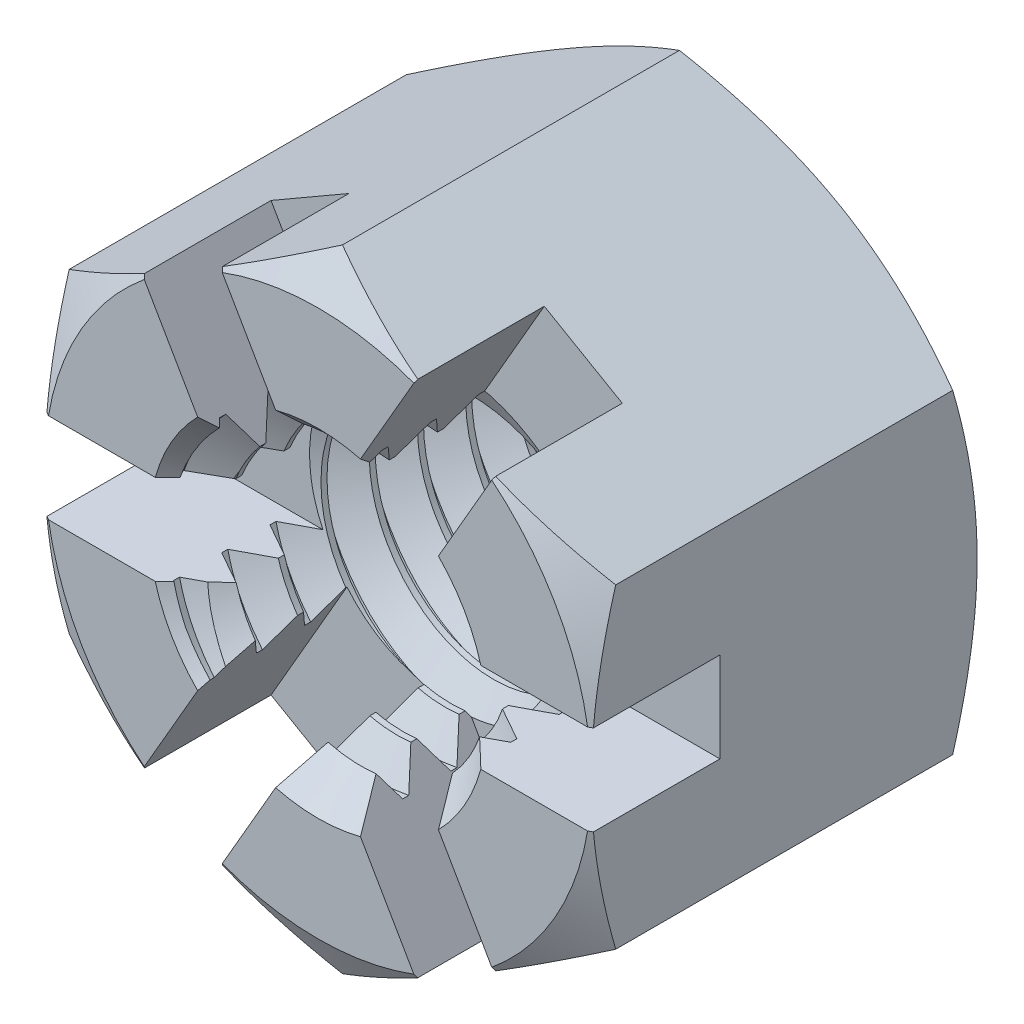
from build123d import *

# Parameters (mm, degrees)
EXTRUDE1_DEPTH      = 12
SKETCH3_OUTSIDE_W   = 89.43
SKETCH3_OUTSIDE_H   = 92.06
SKETCH3_OUTSIDE_R   = 8.5
CUT_EXTRUDE2_DEPTH  = 18.680026395
CUT_EXTRUDE2_DRAFT  = -60
SKETCH4_R           = 5
CUT_EXTRUDE3_DEPTH  = 18.680026395
SKETCH12_R          = 5
SKETCH12_R_2        = 4.025721421
EXTRUDE2_DEPTH      = 12
CUT_SWEEP1_PITCH    = 1.5
SKETCH16_OUTSIDE_W  = 89.43
SKETCH16_OUTSIDE_H  = 92.06
SKETCH16_OUTSIDE_R  = 8.5
CUT_EXTRUDE11_DEPTH = 18.680026463
CUT_EXTRUDE11_DRAFT = -60
CUT_EXTRUDE8_DEPTH  = 4
CIRPATTERN1_COUNT   = 6


with BuildPart() as part:
    # Sketch1 → Extrude1 (new body)
    with BuildSketch(Plane.XY):
        Polygon((0, 9.814954576), (-8.5, 4.907477288), (-8.5, -4.907477288), (0, -9.814954576), (8.5, -4.907477288), (8.5, 4.907477288), align=None)
    extrude(amount=-EXTRUDE1_DEPTH)


with BuildPart() as cut_extrude2_tool:
    # Sketch3 outside → Cut-Extrude2 (with draft: the straight prism first)
    with BuildSketch(Plane(origin=(0, 0, -12), x_dir=(-1, 0, 0), z_dir=(0, 0, -1))):
        Rectangle(SKETCH3_OUTSIDE_W, SKETCH3_OUTSIDE_H)
        Circle(SKETCH3_OUTSIDE_R, mode=Mode.SUBTRACT)
    extrude(amount=-CUT_EXTRUDE2_DEPTH)
    # Cut-Extrude2: the draft: its side faces are tilted about the plane it starts from
    cut_extrude2_sides = [cut_extrude2_tool.faces().sort_by_distance(p)[0] for p in [
        (0, -46.03, -2.659986802),
        (-44.715, 0, -2.659986802),
        (0, 46.03, -2.659986802),
        (44.715, 0, -2.659986802),
        (8.5, 0, -2.659986802),
    ]]
    draft(cut_extrude2_sides, Plane(origin=(0, 0, -12), x_dir=(-1, 0, 0), z_dir=(0, 0, -1)), CUT_EXTRUDE2_DRAFT)


with BuildPart() as part_1:
    add(part.part)

    # Cut-Extrude2: cut by cut_extrude2_tool
    add(cut_extrude2_tool.part, mode=Mode.SUBTRACT)

    # Sketch4 → Cut-Extrude3 (cut, through all)
    with BuildSketch(Plane.XY):
        Circle(SKETCH4_R)
    extrude(amount=-CUT_EXTRUDE3_DEPTH, mode=Mode.SUBTRACT)

    # Sketch12 → Extrude2 (add)
    with BuildSketch(Plane.XY):
        Circle(SKETCH12_R)
        Circle(SKETCH12_R_2, mode=Mode.SUBTRACT)
    extrude(amount=-EXTRUDE2_DEPTH)

    # Cut-Sweep1: the profile of Sketch9 profile screwed along a right-hand helix of 9 turns, 6 arcs to a turn; built about Z, then put on its axis
    cut_sweep1_z = Axis((0, 0, 0), (0, 0, 1))
    cut_sweep1_corners = [(5, 0, -0.75), (5, 0, -0.5625), (4.025421421, 0, 0.000173205), (4.025421421, 0, -1.312673205)]
    with BuildLine(mode=Mode.PRIVATE) as cut_sweep1_profile:
        Line(cut_sweep1_corners[0], cut_sweep1_corners[1])
        Line(cut_sweep1_corners[1], cut_sweep1_corners[2])
        Line(cut_sweep1_corners[2], cut_sweep1_corners[3])
        Line(cut_sweep1_corners[3], cut_sweep1_corners[0])
    cut_sweep1_cap = Face(cut_sweep1_profile.wire())
    cut_sweep1_turn_angles = [0, 30, 60, 90, 120, 150, 180, 210, 240, 270, 300, 330, 360]
    cut_sweep1_turn_weights = [1, 0.8660254037844387, 1, 0.8660254037844387, 1, 0.8660254037844387, 1, 0.8660254037844387, 1, 0.8660254037844387, 1, 0.8660254037844387, 1]
    cut_sweep1_turn_rails = [Edge.make_bspline([Vector(p[0], p[1], 0).rotate(cut_sweep1_z, cut_sweep1_turn_angles[k]) / cut_sweep1_turn_weights[k] + Vector(0, 0, p[2] + CUT_SWEEP1_PITCH * cut_sweep1_turn_angles[k] / 360) for k in range(13)], [0, 0, 0, 1, 1, 2, 2, 3, 3, 4, 4, 5, 5, 6, 6, 6], 2, cut_sweep1_turn_weights) for p in cut_sweep1_corners]
    cut_sweep1_turn_sides = [Face.make_surface_from_curves(cut_sweep1_turn_rails[p[0]], cut_sweep1_turn_rails[p[1]]) for p in [(0, 1), (1, 2), (2, 3), (3, 0)]]
    cut_sweep1 = Plane(origin=(0, 0, 0), x_dir=(0, 1, 0), z_dir=(0, 0, -1)) * Solid(Shell([*[p.moved(Location((0, 0, CUT_SWEEP1_PITCH * i))) for i in range(9) for p in cut_sweep1_turn_sides], cut_sweep1_cap, cut_sweep1_cap.rotate(cut_sweep1_z, 3240).moved(Location((0, 0, CUT_SWEEP1_PITCH * 3240 / 360)))]))
    add(cut_sweep1, mode=Mode.SUBTRACT)

    # Cut-Extrude6 cone 1 section (through the dimple's axis) → Cut-Extrude6 (revolve, cut)
    with BuildSketch(Plane(origin=(0, 0, 0), x_dir=(0, -1, 0), z_dir=(1, 0, 0))):
        Polygon((0, 0), (5.254, 0), (0, 5.254), align=None)
    revolve(axis=Axis((0, 0, 0), (0, 0, -1)), mode=Mode.SUBTRACT)

    # Cut-Extrude7 cone 1 section (through the dimple's axis) → Cut-Extrude7 (revolve, cut)
    with BuildSketch(Plane(origin=(0, 0, -12), x_dir=(0, 1, 0), z_dir=(1, 0, 0))):
        Polygon((0, 0), (5.254, 0), (0, 5.254), align=None)
    revolve(axis=Axis((0, 0, -12), (0, 0, 1)), mode=Mode.SUBTRACT)


with BuildPart() as cut_extrude11_tool:
    # Sketch16 outside → Cut-Extrude11 (with draft: the straight prism first)
    with BuildSketch(Plane.XY):
        Rectangle(SKETCH16_OUTSIDE_W, SKETCH16_OUTSIDE_H)
        Circle(SKETCH16_OUTSIDE_R, mode=Mode.SUBTRACT)
    extrude(amount=-CUT_EXTRUDE11_DEPTH)
    # Cut-Extrude11: the draft: its side faces are tilted about the plane it starts from
    cut_extrude11_sides = [cut_extrude11_tool.faces().sort_by_distance(p)[0] for p in [
        (0, -46.03, -9.340013232),
        (44.715, 0, -9.340013232),
        (0, 46.03, -9.340013232),
        (-44.715, 0, -9.340013232),
        (-8.5, 0, -9.340013232),
    ]]
    draft(cut_extrude11_sides, Plane.XY, CUT_EXTRUDE11_DRAFT)


with BuildPart() as part_2:
    add(part_1.part)

    # Cut-Extrude11: cut by cut_extrude11_tool
    add(cut_extrude11_tool.part, mode=Mode.SUBTRACT)

    # Sketch13 → Cut-Extrude8 (cut)
    with BuildSketch(Plane.XY):
        Polygon((-1.212435565, 0.7), (1.212435565, -0.7), (5.462435565, 6.661215932), (3.037564435, 8.061215932), align=None)
    cut_extrude8 = extrude(amount=-CUT_EXTRUDE8_DEPTH, mode=Mode.SUBTRACT)

    # CirPattern1: Cut-Extrude8 ×6 about axis
    cirpattern1_axis = Axis((0, 0, 0), (0, 0, 1))
    for i in range(1, CIRPATTERN1_COUNT):
        add(cut_extrude8.rotate(cirpattern1_axis, i * 360 / CIRPATTERN1_COUNT), mode=Mode.SUBTRACT)


solid = part_2.part
